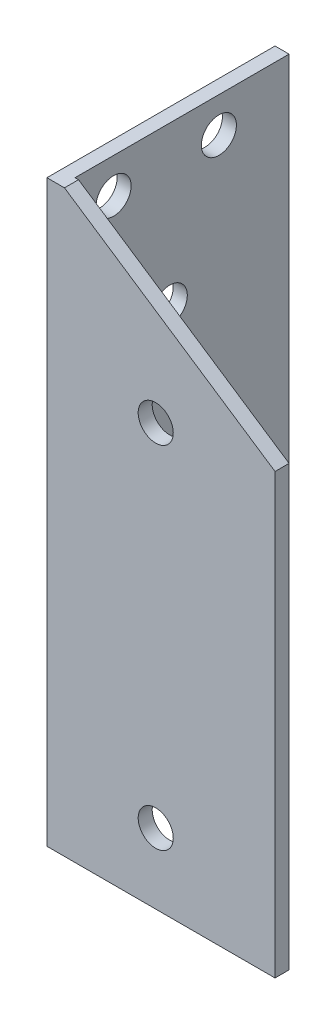
from build123d import *

# Parameters (mm, degrees)
EXTRUDE_1_DEPTH     = 165
SKETCH_2_R          = 5
CUT_EXTRUDE_1_DEPTH = 10
SKETCH_3_R          = 5
CUT_EXTRUDE_2_DEPTH = 10
CUT_EXTRUDE_3_DEPTH = 189.878267675


with BuildPart() as part:
    # Эскиз1 → Вытянуть-Тонкостенный1 (new body)
    with BuildSketch(Plane(origin=(0, 0, 0), x_dir=(1, 0, 0), z_dir=(0, 1, 0))):
        Polygon((0, 65), (0, 0), (65, 0), (65, 4), (4, 4), (4, 65), align=None)
    extrude(amount=EXTRUDE_1_DEPTH)

    # Эскиз2 → Вырез-Вытянуть1 (cut)
    with BuildSketch(Plane.XY):
        with Locations((31, 120)):
            Circle(SKETCH_2_R)
        with Locations((31, 20)):
            Circle(SKETCH_2_R)
    extrude(amount=-CUT_EXTRUDE_1_DEPTH, mode=Mode.SUBTRACT)

    # Эскиз3 → Вырез-Вытянуть2 (cut)
    with BuildSketch(Plane.ZY):
        with Locations((-31, 120)):
            Circle(SKETCH_3_R)
        with Locations((-31, 20)):
            Circle(SKETCH_3_R)
        with Locations((-15, 155)):
            Circle(SKETCH_3_R)
        with Locations((-45, 155)):
            Circle(SKETCH_3_R)
    extrude(amount=-CUT_EXTRUDE_2_DEPTH, mode=Mode.SUBTRACT)

    # Эскиз4 → Вырез-Вытянуть3 (cut, through all)
    with BuildSketch(Plane.XY):
        Polygon((5, 165), (65, 125), (65, 165), align=None)
    extrude(amount=-CUT_EXTRUDE_3_DEPTH, mode=Mode.SUBTRACT)


solid = part.part
